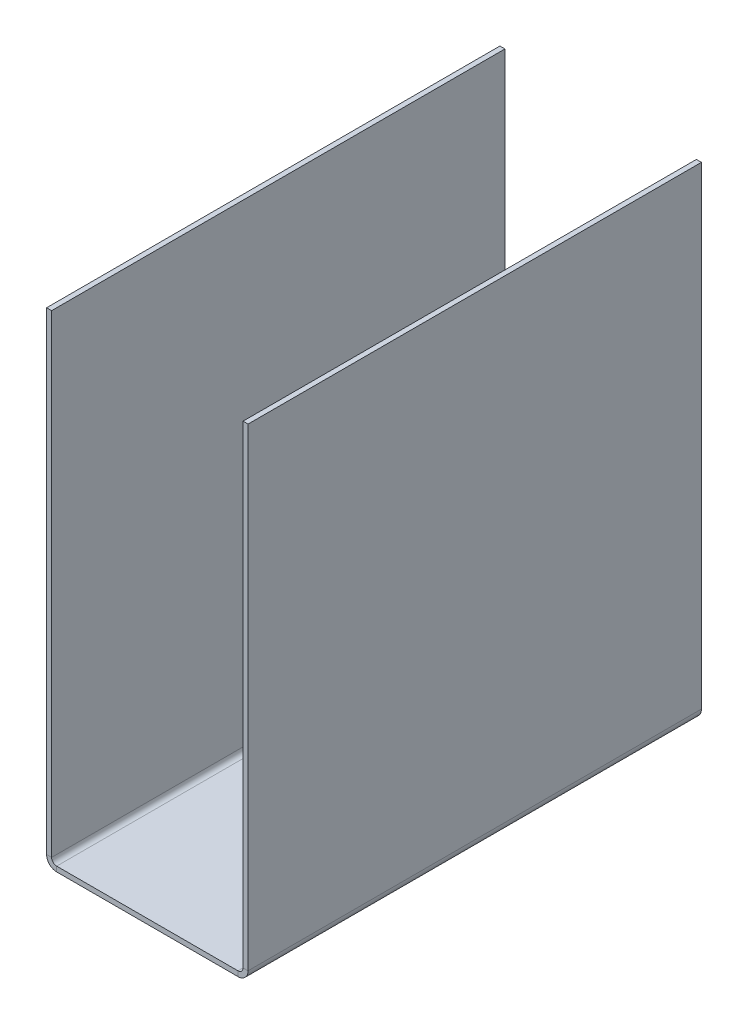
from build123d import *

# Parameters (mm, degrees)
SKETCH_1_W            = 200
SKETCH_1_H            = 480
EXTRUDE_1_DEPTH       = 5
FILLET_1_R            = 5
EXTRUDE_START         = 450
EXTRUDE_3_DEPTH       = 450
CUT_EXTRUDE_START     = -5
CUT_EXTRUDE_2_DEPTH   = 5
SHEET_START           = 5
SHEET_METAL_3_DEPTH   = 450
SHEET_METAL_3_2_DEPTH = 450


# Read off the part's stored shape, not the designer's step: 转换实体3
with BuildPart() as part:
    # 草图1 → 凸台-拉伸1 (new body)
    with BuildSketch(Plane.XY):
        Rectangle(SKETCH_1_W, SKETCH_1_H)
    extrude(amount=EXTRUDE_1_DEPTH)

    # 圆角1
    fillet_1_edges = [part.edges().sort_by_distance(p)[0] for p in [
        (100, -240, 2.5),
        (-100, -240, 2.5),
    ]]
    fillet(fillet_1_edges, radius=FILLET_1_R)

    # 草图4 → 凸台-拉伸3 (add)
    with BuildSketch(Plane.XY.offset(5).offset(EXTRUDE_START)):
        with BuildLine():
            Line((-95, 240), (-95, -235))
            Line((-95, -235), (95, -235))
            Line((95, -235), (95, 240))
            Line((95, 240), (100, 240))
            Line((100, 240), (100, -235))
            ThreePointArc((100, -235), (98.535533906, -238.535533906), (95, -240))
            Line((95, -240), (-95, -240))
            ThreePointArc((-95, -240), (-98.535533906, -238.535533906), (-100, -235))
            Line((-100, -235), (-100, 240))
            Line((-100, 240), (-95, 240))
        make_face()
    extrude(amount=-EXTRUDE_3_DEPTH)

    # Sketch 5 → 切除-拉伸2 (cut)
    with BuildSketch(Plane(origin=(0, 0, 0), x_dir=(-1, 0, 0), z_dir=(0, 0, -1)).offset(CUT_EXTRUDE_START)):
        with BuildLine():
            Line((-95, -240), (95, -240))
            ThreePointArc((95, -240), (98.535533906, -238.535533906), (100, -235))
            Line((100, -235), (100, 240))
            Line((100, 240), (-100, 240))
            Line((-100, 240), (-100, -235))
            ThreePointArc((-100, -235), (-98.535533906, -238.535533906), (-95, -240))
        make_face()
    extrude(amount=CUT_EXTRUDE_2_DEPTH, mode=Mode.SUBTRACT)

    # Sheet Metal 3 outline → Sheet Metal 3 (cut)
    with BuildSketch(Plane.XY.offset(SHEET_START)):
        with BuildLine():
            Line((-95, -240), (-90, -240))
            ThreePointArc((-90, -240), (-97.071067812, -237.071067812), (-100, -230))
            Line((-100, -230), (-100, -235))
            ThreePointArc((-100, -235), (-98.535533906, -238.535533906), (-95, -240))
        make_face()
        with BuildLine():
            ThreePointArc((100, -230), (97.071067812, -237.071067812), (90, -240))
            Line((90, -240), (95, -240))
            ThreePointArc((95, -240), (98.535533906, -238.535533906), (100, -235))
            Line((100, -235), (100, -230))
        make_face()
    extrude(amount=SHEET_METAL_3_DEPTH, mode=Mode.SUBTRACT)

    # Sheet Metal 3 2 outline → Sheet Metal 3 2 (add)
    with BuildSketch(Plane.XY.offset(SHEET_START)):
        with BuildLine():
            Line((-95, -235), (-90, -235))
            ThreePointArc((-90, -235), (-93.535533906, -233.535533906), (-95, -230))
            Line((-95, -230), (-95, -235))
        make_face()
        with BuildLine():
            ThreePointArc((95, -230), (93.535533906, -233.535533906), (90, -235))
            Line((90, -235), (95, -235))
            Line((95, -235), (95, -230))
        make_face()
    extrude(amount=SHEET_METAL_3_2_DEPTH)


solid = part.part
